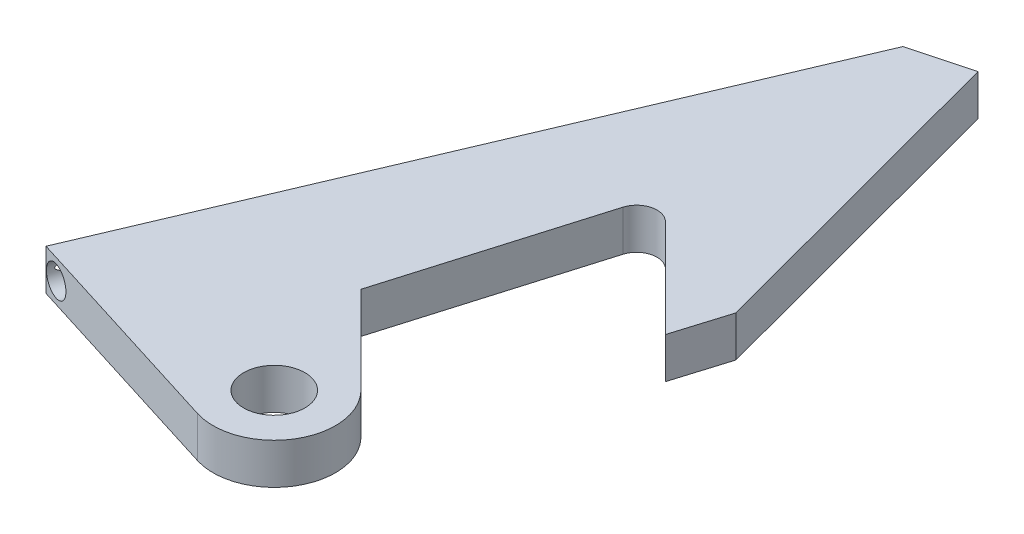
from build123d import *

# Parameters (mm, degrees)
SKETCH1_R                       = 4.7625
BOSS_EXTRUDE1_DEPTH             = 6.35
F_14_0_182_DIAMETER_HOLE1_D     = 4.6228
F_14_0_182_DIAMETER_HOLE1_DEPTH = 2.54
F_14_0_182_DIAMETER_HOLE1_TIP   = 1.388829235


with BuildPart() as part:
    # Sketch1 → Boss-Extrude1 (new body)
    with BuildSketch(Plane(origin=(0, 0, 0), x_dir=(1, 0, 0), z_dir=(0, 1, 0))):
        with BuildLine():
            Line((-2.715472603, -50.452570894), (-16.449210706, -36.716165316))
            Line((-16.449210706, -36.716165316), (-7.143929399, -5.302062091))
            ThreePointArc((-7.143929399, -5.302062091), (-4.881213446, -3.126502672), (-1.85461271, -3.95874678))
            Line((-1.85461271, -3.95874678), (13.315573809, -19.128933299))
            Line((13.315573809, -19.128933299), (15.879471691, -10.753687697))
            Line((15.879471691, -10.753687697), (2.2197595, 40.561165667))
            Line((2.2197595, 40.561165667), (-6.994225827, 38.108456959))
            Line((-6.994225827, 38.108456959), (-46.728023778, -55.399752843))
            Line((-46.728023778, -55.399752843), (-12.38156047, -66.157106701))
            ThreePointArc((-12.38156047, -66.157106701), (-1.47172138, -62.045085351), (-2.715472603, -50.452570894))
        make_face()
        with Locations((-9.583361485, -57.052398719)):
            Circle(SKETCH1_R, mode=Mode.SUBTRACT)
    extrude(amount=BOSS_EXTRUDE1_DEPTH)

    # #14 (0.182) Diameter Hole1
    with Locations(Plane(origin=(-19.975553156, 0, 63.778659005), x_dir=(0.9542892760421928, 0, 0.29888455569143674), z_dir=(-0.29888455569143674, 0, 0.9542892760421928))):
        with Locations((-25.620921468, 3.175)):
            Hole(F_14_0_182_DIAMETER_HOLE1_D / 2, depth=F_14_0_182_DIAMETER_HOLE1_DEPTH)
            with Locations((0, 0, -(F_14_0_182_DIAMETER_HOLE1_DEPTH + F_14_0_182_DIAMETER_HOLE1_TIP / 2))):  # 118° drill point
                Cone(0, F_14_0_182_DIAMETER_HOLE1_D / 2, F_14_0_182_DIAMETER_HOLE1_TIP, mode=Mode.SUBTRACT)


solid = part.part
